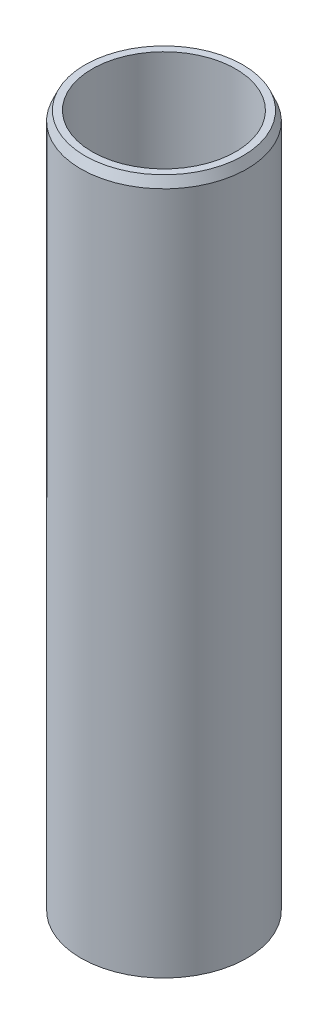
from build123d import *
from OCP.BRepFilletAPI import BRepFilletAPI_MakeChamfer

# Parameters (mm, degrees)
SKETCH1_R           = 52.5
BOSS_EXTRUDE1_DEPTH = 440.626502463
SKETCH2_R           = 45.393963113
CUT_EXTRUDE1_DEPTH  = 447.838018383
CHAMFER1_SIZE       = 5.884158219
CHAMFER1_SIZE2      = 2.589343889


with BuildPart() as part:
    # Sketch1 → Boss-Extrude1 (new body)
    with BuildSketch(Plane(origin=(0, 0, 0), x_dir=(1, 0, 0), z_dir=(0, 1, 0))):
        Circle(SKETCH1_R)
    extrude(amount=BOSS_EXTRUDE1_DEPTH)

    # Sketch2 → Cut-Extrude1 (cut, through all)
    with BuildSketch(Plane(origin=(0, 0, 0), x_dir=(1, 0, 0), z_dir=(0, 1, 0))):
        Circle(SKETCH2_R)
    extrude(amount=CUT_EXTRUDE1_DEPTH, mode=Mode.SUBTRACT)

    # Chamfer1: one chamfer whose edges measure the first distance from different faces: ONE call of the kernel's chamfer builder (chamfer() names one face for all edges)
    chamfer1_edges_1 = [part.edges().sort_by_distance(p)[0] for p in [
        (-52.5, 440.626502463, 0),
    ]]
    chamfer1_side_1 = [part.faces().sort_by_distance(p)[0] for p in [
        (-52.5, 220.313251231, 0),
    ]]
    chamfer1_edges_2 = [part.edges().sort_by_distance(p)[0] for p in [
        (-52.5, 0, 0),
    ]]
    chamfer1_side_2 = [part.faces().sort_by_distance(p)[0] for p in [
        (-51.01507576, 0, 0),
    ]]
    chamfer1 = BRepFilletAPI_MakeChamfer(part.part.solid().wrapped)
    for e in chamfer1_edges_1:
        chamfer1.Add(CHAMFER1_SIZE, CHAMFER1_SIZE2, e.wrapped, chamfer1_side_1[0].wrapped)  # the first distance lies on this face
    for e in chamfer1_edges_2:
        chamfer1.Add(CHAMFER1_SIZE, CHAMFER1_SIZE2, e.wrapped, chamfer1_side_2[0].wrapped)  # the first distance lies on this face
    add(Compound.cast(chamfer1.Shape()), mode=Mode.REPLACE)


solid = part.part
